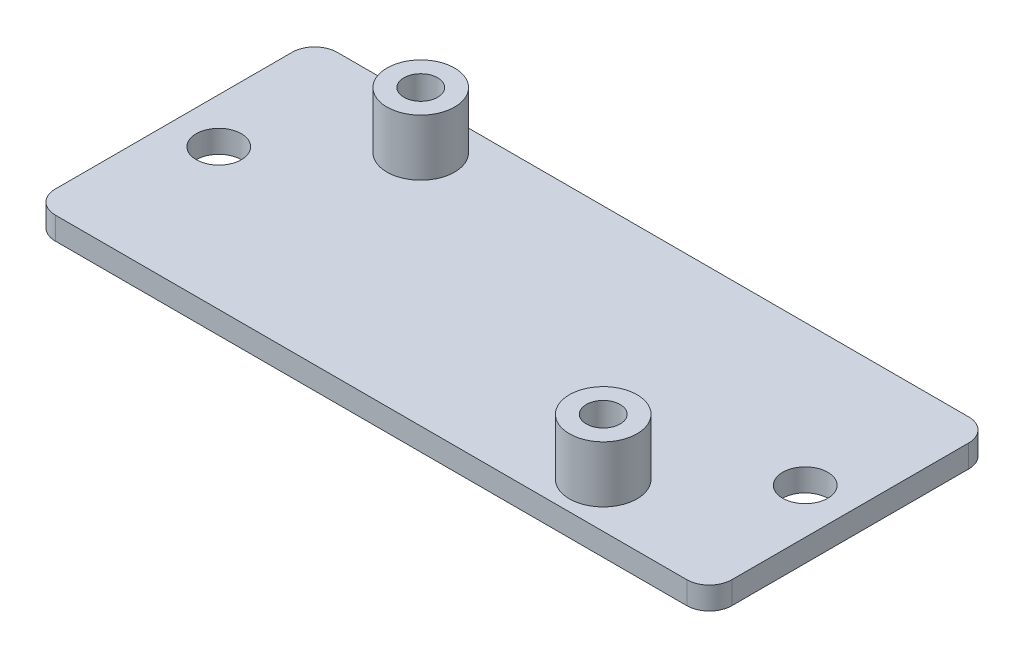
from build123d import *

# Parameters (mm, degrees)
SKETCH_1_W               = 60
SKETCH_1_H               = 25
EXTRUDE_1_DEPTH          = 2
SKETCH_2_R               = 3
EXTRUDE_2_DEPTH          = 5
CUT_EXTRUDE_1_DEPTH      = 66.375836515
CUT_EXTRUDE_1_DEPTH_BACK = 66.375836515
SKETCH_3_R               = 1.5
CUT_EXTRUDE_2_DEPTH      = 66.192024052
CUT_EXTRUDE_2_DEPTH_BACK = 66.192024052
SKETCH_4_R               = 2
FILLET_1_R               = 2
FILLET_2_R               = 2
FILLET_3_R               = 2
FILLET_4_R               = 2


with BuildPart() as part:
    # Эскиз1 → Бобышка-Вытянуть1 (new body)
    with BuildSketch(Plane(origin=(0, 0, 0), x_dir=(1, 0, 0), z_dir=(0, 1, 0))):
        with Locations((30, -12.5)):
            Rectangle(SKETCH_1_W, SKETCH_1_H)
    extrude(amount=EXTRUDE_1_DEPTH)

    # Эскиз2 → Бобышка-Вытянуть2 (add)
    with BuildSketch(Plane(origin=(0, 2, 0), x_dir=(1, 0, 0), z_dir=(0, 1, 0))):
        with Locations((13.41, -4)):
            Circle(SKETCH_2_R)
        with Locations((46.59, -21)):
            Circle(SKETCH_2_R)
    extrude(amount=EXTRUDE_2_DEPTH)

    # Эскиз3 → Вырез-Вытянуть1 (cut, two sides: drawn at the far end of the back side and taken through both)
    with BuildSketch(Plane(origin=(0, 7, 0), x_dir=(1, 0, 0), z_dir=(0, 1, 0)).offset(-CUT_EXTRUDE_1_DEPTH_BACK)):
        with Locations((13.41, -4)):
            Circle(SKETCH_3_R)
        with Locations((46.59, -21)):
            Circle(SKETCH_3_R)
    extrude(amount=CUT_EXTRUDE_1_DEPTH + CUT_EXTRUDE_1_DEPTH_BACK, mode=Mode.SUBTRACT)

    # Эскиз4 → Вырез-Вытянуть2 (cut, two sides: drawn at the far end of the back side and taken through both)
    with BuildSketch(Plane(origin=(0, 2, 0), x_dir=(1, 0, 0), z_dir=(0, 1, 0)).offset(-CUT_EXTRUDE_2_DEPTH_BACK)):
        with Locations((4, -12.5)):
            Circle(SKETCH_4_R)
        with Locations((56, -12.5)):
            Circle(SKETCH_4_R)
    extrude(amount=CUT_EXTRUDE_2_DEPTH + CUT_EXTRUDE_2_DEPTH_BACK, mode=Mode.SUBTRACT)

    # Скругление1
    fillet_1_edges = [part.edges().sort_by_distance(p)[0] for p in [
        (0, 1, 0),
    ]]
    fillet(fillet_1_edges, radius=FILLET_1_R)

    # Скругление2
    fillet_2_edges = [part.edges().sort_by_distance(p)[0] for p in [
        (0, 1, 25),
    ]]
    fillet(fillet_2_edges, radius=FILLET_2_R)

    # Скругление3
    fillet_3_edges = [part.edges().sort_by_distance(p)[0] for p in [
        (60, 1, 25),
    ]]
    fillet(fillet_3_edges, radius=FILLET_3_R)

    # Скругление4
    fillet_4_edges = [part.edges().sort_by_distance(p)[0] for p in [
        (60, 1, 0),
    ]]
    fillet(fillet_4_edges, radius=FILLET_4_R)


solid = part.part
